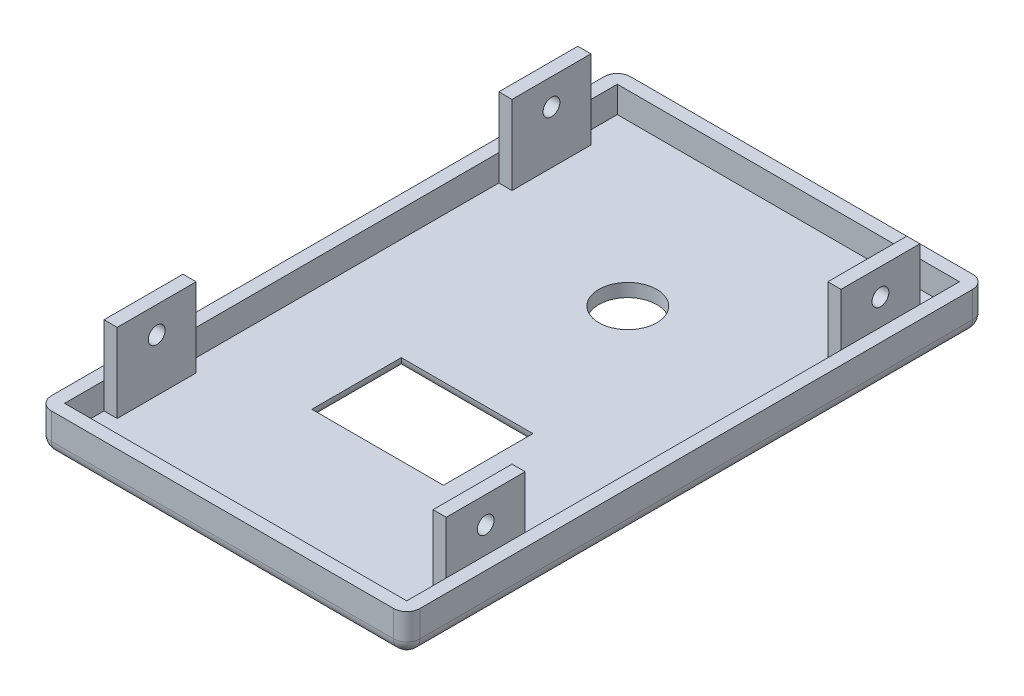
from build123d import *

# Parameters (mm, degrees)
SKETCH2_W           = 70
SKETCH2_H           = 110
BOSS_EXTRUDE1_DEPTH = 2.5
SKETCH3_W           = 65
SKETCH3_H           = 2.5
BOSS_EXTRUDE2_DEPTH = 5
SKETCH4_W           = 2.5
SKETCH4_H           = 15
BOSS_EXTRUDE3_DEPTH = 15
SKETCH6_R           = 1.6
CUT_EXTRUDE1_DEPTH  = 89.811598342
SKETCH7_W           = 25
SKETCH7_H           = 17
SKETCH7_R           = 5.5
CUT_EXTRUDE2_DEPTH  = 68.5
FILLET1_R           = 2.5
FILLET2_R           = 2.5


with BuildPart() as part:
    # Sketch2 → Boss-Extrude1 (new body)
    with BuildSketch(Plane(origin=(0, 0, 0), x_dir=(1, 0, 0), z_dir=(0, 1, 0))):
        Rectangle(SKETCH2_W, SKETCH2_H)
    extrude(amount=BOSS_EXTRUDE1_DEPTH)

    # Sketch3 → Boss-Extrude2 (add)
    with BuildSketch(Plane(origin=(0, 2.5, 0), x_dir=(1, 0, 0), z_dir=(0, 1, 0))):
        Polygon((-35, 55), (-35, -55), (-32.5, -55), (-32.5, -52.5), (-32.5, 52.5), (-32.5, 55), align=None)
        Polygon((35, 55), (-32.5, 55), (-32.5, 52.5), (32.5, 52.5), (35, 52.5), align=None)
        Polygon((32.5, -52.5), (32.5, -55), (35, -55), (35, 52.5), (32.5, 52.5), align=None)
        with Locations((0, -53.75)):
            Rectangle(SKETCH3_W, SKETCH3_H)
    extrude(amount=BOSS_EXTRUDE2_DEPTH)

    # Sketch4 → Boss-Extrude3 (add)
    with BuildSketch(Plane(origin=(0, 2.5, 0), x_dir=(1, 0, 0), z_dir=(0, 1, 0))):
        with Locations((-31.25, 37.5)):
            Rectangle(SKETCH4_W, SKETCH4_H)
        with Locations((31.25, 37.5)):
            Rectangle(SKETCH4_W, SKETCH4_H)
        with Locations((31.25, -37.5)):
            Rectangle(SKETCH4_W, SKETCH4_H)
        with Locations((-31.25, -37.5)):
            Rectangle(SKETCH4_W, SKETCH4_H)
    extrude(amount=BOSS_EXTRUDE3_DEPTH)

    # Sketch6 → Cut-Extrude1 (cut, through all)
    with BuildSketch(Plane.ZY.offset(32.5)):
        with Locations((-37.5, 12.5)):
            Circle(SKETCH6_R)
        with Locations((37.5, 12.5)):
            Circle(SKETCH6_R)
    extrude(amount=-CUT_EXTRUDE1_DEPTH, mode=Mode.SUBTRACT)

    # Sketch7 → Cut-Extrude2 (cut, through all)
    with BuildSketch(Plane.XZ):
        with Locations((-0.53, 16.5)):
            Rectangle(SKETCH7_W, SKETCH7_H)
        with Locations(Location((0, -22, 0), (0, 0, 270))):
            Circle(SKETCH7_R)
    extrude(amount=-CUT_EXTRUDE2_DEPTH, mode=Mode.SUBTRACT)

    # Fillet1
    fillet1_edges = [part.edges().sort_by_distance(p)[0] for p in [
        (-0.53, 0, 25),
        (11.97, 0, 16.5),
        (-0.53, 0, 8),
        (-13.03, 0, 16.5),
    ]]
    fillet(fillet1_edges, radius=FILLET1_R - 0.0001)  # a hair under: the kernel refuses the full size

    # Fillet2
    fillet2_edges = [part.edges().sort_by_distance(p)[0] for p in [
        (0, 0, -55),
        (35, 0, 0),
        (0, 0, 55),
        (-35, 0, 0),
        (-35, 3.75, -55),
        (35, 3.75, -55),
        (35, 3.75, 55),
        (-35, 3.75, 55),
    ]]
    fillet(fillet2_edges, radius=FILLET2_R)


solid = part.part
